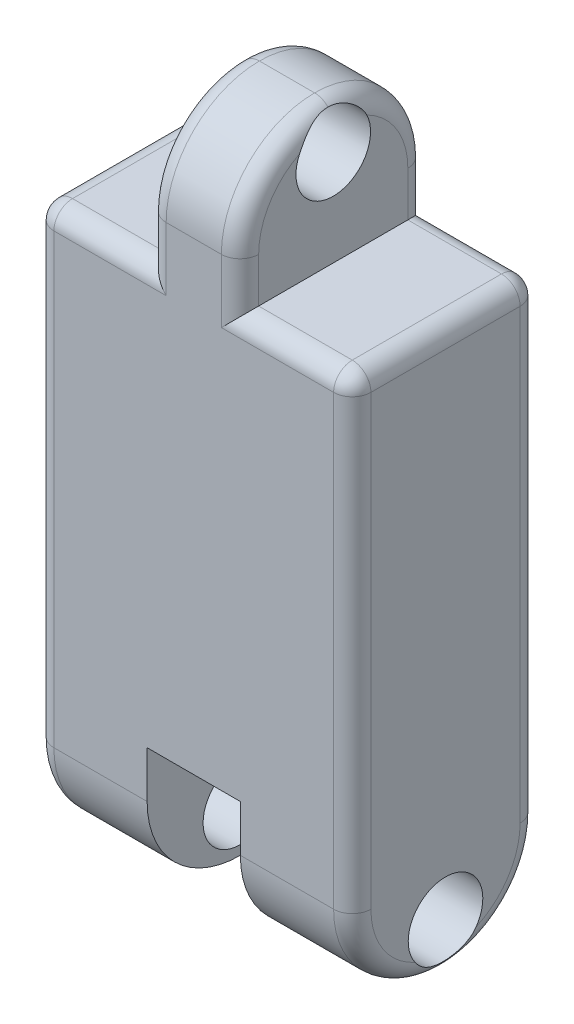
from build123d import *

# Parameters (mm, degrees)
BOSS_EXTRUDE1_DEPTH    = 100
SKETCH2_W              = 50
SKETCH2_H              = 50
CUT_EXTRUDE1_DEPTH     = 260.617025636
FILLET1_R              = 50
CUT_EXTRUDE2_DEPTH     = 25
SKETCH7_R              = 20
CUT_EXTRUDE3_DEPTH     = 299.456026912
FILLET2_R              = 50
CUT_EXTRUDE6_START     = -150
CUT_EXTRUDE6_OUTLINE_W = 50
CUT_EXTRUDE6_OUTLINE_H = 6.698729811
CUT_EXTRUDE6_DEPTH     = 50
CUT_EXTRUDE7_DEPTH     = 25
FILLET3_R              = 10
SKETCH11_W             = 50
SKETCH11_H             = 25
CUT_EXTRUDE8_DEPTH     = 99
BOSS_EXTRUDE7_DEPTH    = 0.1
FILLET4_R              = 10
FILLET5_R              = 10
SKETCH14_R             = 20
CUT_EXTRUDE9_DEPTH     = 269.797414546


with BuildPart() as part:
    # Sketch1 → Boss-Extrude1 (new body)
    with BuildSketch(Plane.XY):
        Polygon((-24.8, 150), (-24.8, 224), (24.8, 224), (24.8, 150), (85, 150), (85, -150), (-85, -150), (-85, 150), align=None)
    extrude(amount=-BOSS_EXTRUDE1_DEPTH)

    # Sketch2 → Cut-Extrude1 (cut, through all)
    with BuildSketch(Plane.XY):
        with Locations((0, -150)):
            Rectangle(SKETCH2_W, SKETCH2_H)
    extrude(amount=-CUT_EXTRUDE1_DEPTH, mode=Mode.SUBTRACT)

    # Fillet1
    fillet1_edges = [part.edges().sort_by_distance(p)[0] for p in [
        (0, 224, -100),
        (0, 224, 0),
    ]]
    fillet(fillet1_edges, radius=FILLET1_R - 0.0001)  # a hair under: the kernel refuses the full size

    # Sketch6 → Cut-Extrude2 (cut, symmetric)
    with BuildSketch(Plane(origin=(0, 0, 0), x_dir=(0, 0, -1), z_dir=(1, 0, 0))):
        with BuildLine():
            Line((100, -125), (0, -125))
            ThreePointArc((0, -125), (50, -75), (100, -125))
        make_face()
    extrude(amount=CUT_EXTRUDE2_DEPTH, both=True, mode=Mode.SUBTRACT)

    # Sketch7 → Cut-Extrude3 (cut, through all)
    with BuildSketch(Plane.ZY.offset(85)):
        with Locations(Location((-50, -125, 0), (0, 0, 270))):
            Circle(SKETCH7_R)
    extrude(amount=-CUT_EXTRUDE3_DEPTH, mode=Mode.SUBTRACT)

    # Fillet2
    fillet2_edges = [part.edges().sort_by_distance(p)[0] for p in [
        (-55, -150, -100),
        (-55, -150, 0),
    ]]
    fillet(fillet2_edges, radius=FILLET2_R - 0.0001)  # a hair under: the kernel refuses the full size

    # Cut-Extrude6: read off the stored shape, not the designer's step
    # Cut-Extrude6 outline → Cut-Extrude6 (cut)
    with BuildSketch(Plane(origin=(0, 0, 0), x_dir=(1, 0, 0), z_dir=(0, 1, 0)).offset(CUT_EXTRUDE6_START)):
        with Locations((0, 96.650635095)):
            Rectangle(CUT_EXTRUDE6_OUTLINE_W, CUT_EXTRUDE6_OUTLINE_H)
        with Locations((0, 3.349364906)):
            Rectangle(CUT_EXTRUDE6_OUTLINE_W, CUT_EXTRUDE6_OUTLINE_H)
    extrude(amount=CUT_EXTRUDE6_DEPTH, mode=Mode.SUBTRACT)

    # Sketch10 → Cut-Extrude7 (cut, symmetric)
    with BuildSketch(Plane(origin=(0, 0, 0), x_dir=(0, 0, -1), z_dir=(1, 0, 0))):
        with BuildLine():
            Line((0, -100), (100, -100))
            ThreePointArc((100, -100), (50, -86.611517322), (0, -100))
        make_face()
    extrude(amount=CUT_EXTRUDE7_DEPTH, both=True, mode=Mode.SUBTRACT)

    # Fillet3
    # the kernel refuses this fillet: 10 mm, written as the material it takes off along each edge
    with BuildSketch(Plane(origin=(24.8, 174.0001, -100), x_dir=(0, 0, 1), z_dir=(0, -1, 0)), Plane(origin=(-24.8, 150, 0), x_dir=(1, 0, 0), z_dir=(0, 1, 0)), Plane(origin=(-24.8, 150, -100), x_dir=(0, 0, 1), z_dir=(0, 1, 0)), Plane(origin=(24.8, 174.0001, 0), x_dir=(-1, 0, 0), z_dir=(0, -1, 0))) as fillet3_piece_1:
        with BuildLine():
            CenterArc((FILLET3_R, FILLET3_R), FILLET3_R, 180, 90)
            Line((0, FILLET3_R), (0, 0))
            Line((0, 0), (FILLET3_R, 0))
        make_face()
    extrude(amount=24.0001, mode=Mode.SUBTRACT)
    with BuildSketch(Plane(origin=(24.8, 150, 0), x_dir=(0, -1, 0), z_dir=(1, 0, 0)), Plane(origin=(-110, 150, -100), x_dir=(0, 0, 1), z_dir=(1, 0, 0)), Plane(origin=(24.8, 150, -100), x_dir=(0, 0, 1), z_dir=(1, 0, 0)), Plane(origin=(-110, 150, 0), x_dir=(0, -1, 0), z_dir=(1, 0, 0))) as fillet3_piece_2:
        with BuildLine():
            CenterArc((FILLET3_R, FILLET3_R), FILLET3_R, 180, 90)
            Line((0, FILLET3_R), (0, 0))
            Line((0, 0), (FILLET3_R, 0))
        make_face()
    extrude(amount=85.2, mode=Mode.SUBTRACT)
    with BuildSketch(Plane(origin=(-85, -100.0001, -100), x_dir=(0, 0, 1), z_dir=(0, 1, 0)), Plane(origin=(85, 175, 0), x_dir=(-1, 0, 0), z_dir=(0, -1, 0)), Plane(origin=(85, 175, -100), x_dir=(0, 0, 1), z_dir=(0, -1, 0)), Plane(origin=(-85, -100.0001, 0), x_dir=(1, 0, 0), z_dir=(0, 1, 0))) as fillet3_piece_3:
        with BuildLine():
            CenterArc((FILLET3_R, FILLET3_R), FILLET3_R, 180, 90)
            Line((0, FILLET3_R), (0, 0))
            Line((0, 0), (FILLET3_R, 0))
        make_face()
    extrude(amount=275.0001, mode=Mode.SUBTRACT)
    with BuildSketch(Plane(origin=(-24.8, 174.0001, -49.9999), x_dir=(0, 1, 0), z_dir=(0, 0, -1))) as fillet3_piece_4:
        with BuildLine():
            CenterArc((49.9999 - FILLET3_R, FILLET3_R), FILLET3_R, 270, 90)
            Line((49.9999 - FILLET3_R, 0), (49.9999, 0))
            Line((49.9999, 0), (49.9999, FILLET3_R))
        make_face()
    revolve(axis=Axis((-24.8, 174.0001, -49.9999), (1, 0, 0)), revolution_arc=90, mode=Mode.SUBTRACT)
    with BuildSketch(Plane(origin=(-24.8, 174.0001, -50.0001), x_dir=(0, 1, 0), z_dir=(0, 0, 1))) as fillet3_piece_5:
        with BuildLine():
            CenterArc((49.9999 - FILLET3_R, -FILLET3_R), FILLET3_R, 0, 90)
            Line((49.9999, -FILLET3_R), (49.9999, 0))
            Line((49.9999, 0), (49.9999 - FILLET3_R, 0))
        make_face()
    revolve(axis=Axis((-24.8, 174.0001, -50.0001), (-1, 0, 0)), revolution_arc=90, mode=Mode.SUBTRACT)
    with BuildSketch(Plane(origin=(24.8, 174.0001, -49.9999), x_dir=(0, 1, 0), z_dir=(0, 0, -1))) as fillet3_piece_6:
        with BuildLine():
            CenterArc((49.9999 - FILLET3_R, -FILLET3_R), FILLET3_R, 0, 90)
            Line((49.9999, -FILLET3_R), (49.9999, 0))
            Line((49.9999, 0), (49.9999 - FILLET3_R, 0))
        make_face()
    revolve(axis=Axis((24.8, 174.0001, -49.9999), (1, 0, 0)), revolution_arc=90, mode=Mode.SUBTRACT)
    with BuildSketch(Plane(origin=(24.8, 174.0001, -50.0001), x_dir=(0, 1, 0), z_dir=(0, 0, 1))) as fillet3_piece_7:
        with BuildLine():
            CenterArc((49.9999 - FILLET3_R, FILLET3_R), FILLET3_R, 270, 90)
            Line((49.9999, FILLET3_R), (49.9999, 0))
            Line((49.9999, 0), (49.9999 - FILLET3_R, 0))
        make_face()
    revolve(axis=Axis((24.8, 174.0001, -50.0001), (-1, 0, 0)), revolution_arc=90, mode=Mode.SUBTRACT)
    with BuildSketch(Plane(origin=(85, -100.0001, -49.9999), x_dir=(0, 0, 1), z_dir=(0, 1, 0))) as fillet3_piece_8:
        with BuildLine():
            CenterArc((49.9999 - FILLET3_R, -FILLET3_R), FILLET3_R, 360, 90)
            Line((49.9999, -FILLET3_R), (49.9999, 0))
            Line((49.9999, 0), (49.9999 - FILLET3_R, 0))
        make_face()
    revolve(axis=Axis((85, -100.0001, -49.9999), (1, 0, 0)), revolution_arc=90, mode=Mode.SUBTRACT)
    with BuildSketch(Plane(origin=(85, -100.0001, -50.0001), x_dir=(0, 0, -1), z_dir=(0, 1, 0))) as fillet3_piece_9:
        with BuildLine():
            CenterArc((49.9999 - FILLET3_R, FILLET3_R), FILLET3_R, 270, 90)
            Line((49.9999, FILLET3_R), (49.9999, 0))
            Line((49.9999, 0), (49.9999 - FILLET3_R, 0))
        make_face()
    revolve(axis=Axis((85, -100.0001, -50.0001), (-1, 0, 0)), revolution_arc=90, mode=Mode.SUBTRACT)
    with BuildSketch(Plane(origin=(-85, -100.0001, -49.9999), x_dir=(0, 0, 1), z_dir=(0, 1, 0))) as fillet3_piece_10:
        with BuildLine():
            CenterArc((49.9999 - FILLET3_R, FILLET3_R), FILLET3_R, 270, 90)
            Line((49.9999, FILLET3_R), (49.9999, 0))
            Line((49.9999, 0), (49.9999 - FILLET3_R, 0))
        make_face()
    revolve(axis=Axis((-85, -100.0001, -49.9999), (1, 0, 0)), revolution_arc=90, mode=Mode.SUBTRACT)
    with BuildSketch(Plane(origin=(-85, -100.0001, -50.0001), x_dir=(0, 0, -1), z_dir=(0, 1, 0))) as fillet3_piece_11:
        with BuildLine():
            CenterArc((49.9999 - FILLET3_R, -FILLET3_R), FILLET3_R, 0, 90)
            Line((49.9999, -FILLET3_R), (49.9999, 0))
            Line((49.9999, 0), (49.9999 - FILLET3_R, 0))
        make_face()
    revolve(axis=Axis((-85, -100.0001, -50.0001), (-1, 0, 0)), revolution_arc=90, mode=Mode.SUBTRACT)
    with BuildSketch(Plane(origin=(-85, -150, -49.9999), x_dir=(0, 1, 0), z_dir=(0, 0, -1)), Plane(origin=(24.8, 224, -49.9999), x_dir=(0, -1, 0), z_dir=(0, 0, -1))) as fillet3_piece_12:
        with BuildLine():
            CenterArc((FILLET3_R, FILLET3_R), FILLET3_R, 180, 90)
            Line((0, FILLET3_R), (0, 0))
            Line((0, 0), (FILLET3_R, 0))
        make_face()
    extrude(amount=0.0002, mode=Mode.SUBTRACT)
    with BuildSketch(Plane(origin=(85, -150, -49.9999), x_dir=(0, 1, 0), z_dir=(0, 0, -1)), Plane(origin=(-24.8, 224, -49.9999), x_dir=(0, -1, 0), z_dir=(0, 0, -1))) as fillet3_piece_13:
        with BuildLine():
            CenterArc((FILLET3_R, -FILLET3_R), FILLET3_R, 90, 90)
            Line((0, -FILLET3_R), (0, 0))
            Line((0, 0), (FILLET3_R, 0))
        make_face()
    extrude(amount=0.0002, mode=Mode.SUBTRACT)
    with BuildSketch(Plane(origin=(-0.2, 150, -100), x_dir=(0, 0, 1), z_dir=(1, 0, 0))) as fillet3_piece_14a_section:
        with BuildLine():
            CenterArc((FILLET3_R, FILLET3_R), FILLET3_R, 180, 90)
            Line((0, FILLET3_R), (0, 0))
            Line((0, 0), (FILLET3_R, 0))
        make_face()
    fillet3_piece_14a = extrude(amount=110.2, mode=Mode.PRIVATE)
    fillet3_piece_14a = split(fillet3_piece_14a, bisect_by=Plane(origin=(24.8, 150, -100), z_dir=(-1, 0, 0)), keep=Keep.TOP, mode=Mode.PRIVATE)
    with BuildSketch(Plane(origin=(24.8, 174.0001, -100), x_dir=(0, 0, 1), z_dir=(0, -1, 0))) as fillet3_piece_14b_section:
        with BuildLine():
            CenterArc((FILLET3_R, FILLET3_R), FILLET3_R, 180, 90)
            Line((0, FILLET3_R), (0, 0))
            Line((0, 0), (FILLET3_R, 0))
        make_face()
    fillet3_piece_14b = extrude(amount=49.0001, mode=Mode.PRIVATE)
    fillet3_piece_14b = split(fillet3_piece_14b, bisect_by=Plane(origin=(24.8, 150, -100), z_dir=(0, -1, 0)), keep=Keep.TOP, mode=Mode.PRIVATE)
    fillet3_piece_14 = fillet3_piece_14a & fillet3_piece_14b
    add(fillet3_piece_14, mode=Mode.SUBTRACT)
    with BuildSketch(Plane(origin=(-0.2, 150, 0), x_dir=(0, -1, 0), z_dir=(1, 0, 0))) as fillet3_piece_15a_section:
        with BuildLine():
            CenterArc((FILLET3_R, FILLET3_R), FILLET3_R, 180, 90)
            Line((0, FILLET3_R), (0, 0))
            Line((0, 0), (FILLET3_R, 0))
        make_face()
    fillet3_piece_15a = extrude(amount=110.2, mode=Mode.PRIVATE)
    fillet3_piece_15a = split(fillet3_piece_15a, bisect_by=Plane(origin=(24.8, 150, 0), z_dir=(-1, 0, 0)), keep=Keep.TOP, mode=Mode.PRIVATE)
    with BuildSketch(Plane(origin=(24.8, 174.0001, 0), x_dir=(-1, 0, 0), z_dir=(0, -1, 0))) as fillet3_piece_15b_section:
        with BuildLine():
            CenterArc((FILLET3_R, FILLET3_R), FILLET3_R, 180, 90)
            Line((0, FILLET3_R), (0, 0))
            Line((0, 0), (FILLET3_R, 0))
        make_face()
    fillet3_piece_15b = extrude(amount=49.0001, mode=Mode.PRIVATE)
    fillet3_piece_15b = split(fillet3_piece_15b, bisect_by=Plane(origin=(24.8, 150, 0), z_dir=(0, -1, 0)), keep=Keep.TOP, mode=Mode.PRIVATE)
    fillet3_piece_15 = fillet3_piece_15a & fillet3_piece_15b
    add(fillet3_piece_15, mode=Mode.SUBTRACT)
    with BuildSketch(Plane(origin=(-24.8, 125, -100), x_dir=(0, 0, 1), z_dir=(0, 1, 0))) as fillet3_piece_16a_section:
        with BuildLine():
            CenterArc((FILLET3_R, FILLET3_R), FILLET3_R, 180, 90)
            Line((0, FILLET3_R), (0, 0))
            Line((0, 0), (FILLET3_R, 0))
        make_face()
    fillet3_piece_16a = extrude(amount=49.0001, mode=Mode.PRIVATE)
    fillet3_piece_16a = split(fillet3_piece_16a, bisect_by=Plane(origin=(-24.8, 150, -100), z_dir=(0, -1, 0)), keep=Keep.TOP, mode=Mode.PRIVATE)
    with BuildSketch(Plane(origin=(-110, 150, -100), x_dir=(0, 0, 1), z_dir=(1, 0, 0))) as fillet3_piece_16b_section:
        with BuildLine():
            CenterArc((FILLET3_R, FILLET3_R), FILLET3_R, 180, 90)
            Line((0, FILLET3_R), (0, 0))
            Line((0, 0), (FILLET3_R, 0))
        make_face()
    fillet3_piece_16b = extrude(amount=110.2, mode=Mode.PRIVATE)
    fillet3_piece_16b = split(fillet3_piece_16b, bisect_by=Plane(origin=(-24.8, 150, -100), z_dir=(1, 0, 0)), keep=Keep.TOP, mode=Mode.PRIVATE)
    fillet3_piece_16 = fillet3_piece_16a & fillet3_piece_16b
    add(fillet3_piece_16, mode=Mode.SUBTRACT)
    with BuildSketch(Plane(origin=(-24.8, 125, 0), x_dir=(1, 0, 0), z_dir=(0, 1, 0))) as fillet3_piece_17a_section:
        with BuildLine():
            CenterArc((FILLET3_R, FILLET3_R), FILLET3_R, 180, 90)
            Line((0, FILLET3_R), (0, 0))
            Line((0, 0), (FILLET3_R, 0))
        make_face()
    fillet3_piece_17a = extrude(amount=49.0001, mode=Mode.PRIVATE)
    fillet3_piece_17a = split(fillet3_piece_17a, bisect_by=Plane(origin=(-24.8, 150, 0), z_dir=(0, -1, 0)), keep=Keep.TOP, mode=Mode.PRIVATE)
    with BuildSketch(Plane(origin=(-110, 150, 0), x_dir=(0, -1, 0), z_dir=(1, 0, 0))) as fillet3_piece_17b_section:
        with BuildLine():
            CenterArc((FILLET3_R, FILLET3_R), FILLET3_R, 180, 90)
            Line((0, FILLET3_R), (0, 0))
            Line((0, 0), (FILLET3_R, 0))
        make_face()
    fillet3_piece_17b = extrude(amount=110.2, mode=Mode.PRIVATE)
    fillet3_piece_17b = split(fillet3_piece_17b, bisect_by=Plane(origin=(-24.8, 150, 0), z_dir=(1, 0, 0)), keep=Keep.TOP, mode=Mode.PRIVATE)
    fillet3_piece_17 = fillet3_piece_17a & fillet3_piece_17b
    add(fillet3_piece_17, mode=Mode.SUBTRACT)

    # Sketch11 → Cut-Extrude8 (cut)
    with BuildSketch(Plane.XY):
        with Locations((0, -87.5)):
            Rectangle(SKETCH11_W, SKETCH11_H)
    extrude(amount=-CUT_EXTRUDE8_DEPTH, mode=Mode.SUBTRACT)

    # Fillet5
    # the kernel refuses this fillet: 10 mm, written as the material it takes off along each edge
    with BuildSketch(Plane(origin=(75, 140, -10), x_dir=(0, 1, 0), z_dir=(1, 0, 0))) as fillet5_piece_1_section:
        Polygon((0, 0), (FILLET5_R, 0), (FILLET5_R, FILLET5_R), (0, FILLET5_R), align=None)
    fillet5_piece_1 = extrude(amount=FILLET5_R, mode=Mode.PRIVATE)
    fillet5_piece_1 = fillet5_piece_1 - Plane(origin=(75, 140, -10), x_dir=(0, -0.7071067811865475, -0.7071067811865475), z_dir=(1, 0, 0)) * Sphere(FILLET5_R, mode=Mode.PRIVATE)
    add(fillet5_piece_1, mode=Mode.SUBTRACT)
    with BuildSketch(Plane(origin=(75, 140, -90), x_dir=(0, 1, 0), z_dir=(1, 0, 0))) as fillet5_piece_2_section:
        Polygon((0, 0), (FILLET5_R, 0), (FILLET5_R, -FILLET5_R), (0, -FILLET5_R), align=None)
    fillet5_piece_2 = extrude(amount=FILLET5_R, mode=Mode.PRIVATE)
    fillet5_piece_2 = fillet5_piece_2 - Plane(origin=(75, 140, -90), x_dir=(0, -0.7071067811865475, 0.7071067811865475), z_dir=(1, 0, 0)) * Sphere(FILLET5_R, mode=Mode.PRIVATE)
    add(fillet5_piece_2, mode=Mode.SUBTRACT)
    with BuildSketch(Plane(origin=(-75, 140, -90), x_dir=(0, 1, 0), z_dir=(-1, 0, 0))) as fillet5_piece_3_section:
        Polygon((0, 0), (FILLET5_R, 0), (FILLET5_R, FILLET5_R), (0, FILLET5_R), align=None)
    fillet5_piece_3 = extrude(amount=FILLET5_R, mode=Mode.PRIVATE)
    fillet5_piece_3 = fillet5_piece_3 - Plane(origin=(-75, 140, -90), x_dir=(0, -0.7071067811865475, 0.7071067811865475), z_dir=(-1, 0, 0)) * Sphere(FILLET5_R, mode=Mode.PRIVATE)
    add(fillet5_piece_3, mode=Mode.SUBTRACT)
    with BuildSketch(Plane(origin=(-75, 140, -10), x_dir=(0, 1, 0), z_dir=(-1, 0, 0))) as fillet5_piece_4_section:
        Polygon((0, 0), (FILLET5_R, 0), (FILLET5_R, -FILLET5_R), (0, -FILLET5_R), align=None)
    fillet5_piece_4 = extrude(amount=FILLET5_R, mode=Mode.PRIVATE)
    fillet5_piece_4 = fillet5_piece_4 - Plane(origin=(-75, 140, -10), x_dir=(0, -0.7071067811865475, -0.7071067811865475), z_dir=(-1, 0, 0)) * Sphere(FILLET5_R, mode=Mode.PRIVATE)
    add(fillet5_piece_4, mode=Mode.SUBTRACT)
    with BuildSketch(Plane(origin=(85, 150, -10), x_dir=(0, -1, 0), z_dir=(0, 0, -1))) as fillet5_piece_5:
        with BuildLine():
            CenterArc((FILLET5_R, FILLET5_R), FILLET5_R, 180, 90)
            Line((0, FILLET5_R), (0, 0))
            Line((0, 0), (FILLET5_R, 0))
        make_face()
    extrude(amount=80, mode=Mode.SUBTRACT)
    with BuildSketch(Plane(origin=(-85, 150, -10), x_dir=(0, -1, 0), z_dir=(0, 0, -1))) as fillet5_piece_6:
        with BuildLine():
            CenterArc((FILLET5_R, -FILLET5_R), FILLET5_R, 90, 90)
            Line((0, -FILLET5_R), (0, 0))
            Line((0, 0), (FILLET5_R, 0))
        make_face()
    extrude(amount=80, mode=Mode.SUBTRACT)

    # Sketch14 → Cut-Extrude9 (cut, through all)
    with BuildSketch(Plane(origin=(24.8, 0, 0), x_dir=(0, 0, -1), z_dir=(1, 0, 0))):
        with Locations(Location((50, 201, 0), (0, 0, 25.856016698))):
            Circle(SKETCH14_R)
    extrude(amount=-CUT_EXTRUDE9_DEPTH, mode=Mode.SUBTRACT)


with BuildPart() as body_2:
    # Sketch13 → Boss-Extrude7 (new body)
    with BuildSketch(Plane(origin=(0, 0, -100), x_dir=(-1, 0, 0), z_dir=(0, 0, -1))):
        Polygon((-25, -100), (-25, -130), (25.018802851, -130), (25, -100), align=None)
    extrude(amount=BOSS_EXTRUDE7_DEPTH)

    # Fillet4
    # the kernel refuses this fillet: 10 mm, written as the material it takes off along each edge
    with BuildSketch(Plane(origin=(-25.021013242, -133.526683302, -100.1), x_dir=(0, 0, 1), z_dir=(0.0006267615930631998, 0.9999998035849335, 0))) as fillet4_piece_1:
        with BuildLine():
            CenterArc((10, 1.410673598), FILLET4_R, 180, 8.109614456)
            Line((0, 1.410673598), (0, 0))
            Line((0, 0), (0.1, 0))
        make_face()
    extrude(amount=37.053373882, mode=Mode.SUBTRACT)
    with BuildSketch(Plane(origin=(25, -96.473316005, -100.1), x_dir=(0, 0, 1), z_dir=(0, -1, 0))) as fillet4_piece_2:
        with BuildLine():
            CenterArc((10, 1.410673598), FILLET4_R, 180, 8.109614456)
            Line((0, 1.410673598), (0, 0))
            Line((0, 0), (0.1, 0))
        make_face()
    extrude(amount=37.05336799, mode=Mode.SUBTRACT)
    with BuildSketch(Plane(origin=(28.526683995, -130, -100.1), x_dir=(0, 0, 1), z_dir=(-1, 0, 0))) as fillet4_piece_3:
        with BuildLine():
            CenterArc((10, 1.410673598), FILLET4_R, 180, 8.109614456)
            Line((0, 1.410673598), (0, 0))
            Line((0, 0), (0.1, 0))
        make_face()
    extrude(amount=57.072170841, mode=Mode.SUBTRACT)


solid = Compound([part.part, body_2.part])
